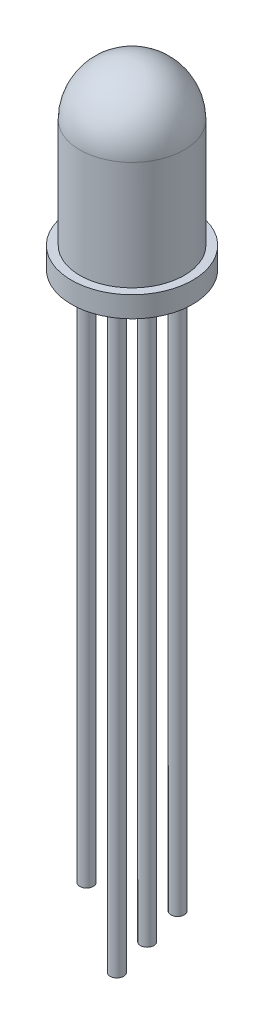
from build123d import *

# Parameters (mm, degrees)
SKETCH2_R           = 0.3219
BOSS_EXTRUDE1_DEPTH = 26.5
SKETCH2_3_R         = 0.3219
BOSS_EXTRUDE2_DEPTH = 29.5
SKETCH2_4_R         = 0.3219
BOSS_EXTRUDE3_DEPTH = 27.5
SKETCH2_5_R         = 0.3219
BOSS_EXTRUDE4_DEPTH = 25.5
SPLIT1_START        = -26.5
SPLIT1_OUTLINE_R    = 0.3219
SPLIT1_DEPTH        = 26.5
SPLIT1_START_2      = -29.5
SPLIT1_2_OUTLINE_R  = 0.3219
SPLIT1_2_DEPTH      = 29.5
SPLIT1_START_3      = -27.5
SPLIT1_3_OUTLINE_R  = 0.3219
SPLIT1_3_DEPTH      = 27.5
SPLIT1_START_4      = -25.5
SPLIT1_4_OUTLINE_R  = 0.3219
SPLIT1_4_DEPTH      = 25.5
SPLIT1_5_OUTLINE_R  = 2.9
SPLIT1_5_DEPTH      = 1
SPLIT1_6_OUTLINE_R  = 2.9
SPLIT1_6_DEPTH      = 30.5


# Read off the part's stored shape, not the designer's step: Split1
with BuildPart() as part:
    # Sketch1 → Revolve1 (revolve)
    with BuildSketch(Plane.XY, mode=Mode.PRIVATE) as revolve1_sk:
        with BuildLine():
            Line((0, 0), (2.9, 0))
            Line((2.9, 0), (2.9, 1))
            Line((2.9, 1), (2.5, 1))
            Line((2.5, 1), (2.5, 6.2))
            ThreePointArc((2.5, 6.2), (1.767766953, 7.967766953), (0, 8.7))
            Line((0, 8.7), (0, 0))
        make_face()
    revolve(revolve1_sk.sketch.rotate(Axis((0, 0, 0), (0, 1, 0)), 90), axis=Axis((0, 0, 0), (0, 1, 0)))

    # Sketch2 → Boss-Extrude1 (add)
    with BuildSketch(Plane.XZ):
        with Locations(Location((-2.1781, 0, 0), (0, 0, 270))):
            Circle(SKETCH2_R)
    extrude(amount=BOSS_EXTRUDE1_DEPTH)

    # Sketch2<3> → Boss-Extrude2 (add)
    with BuildSketch(Plane.XZ):
        with Locations(Location((-0.726033333, 0, 0), (0, 0, 270))):
            Circle(SKETCH2_3_R)
    extrude(amount=BOSS_EXTRUDE2_DEPTH)

    # Sketch2<4> → Boss-Extrude3 (add)
    with BuildSketch(Plane.XZ):
        with Locations(Location((0.726033333, 0, 0), (0, 0, 270))):
            Circle(SKETCH2_4_R)
    extrude(amount=BOSS_EXTRUDE3_DEPTH)

    # Sketch2<5> → Boss-Extrude4 (add)
    with BuildSketch(Plane.XZ):
        with Locations(Location((2.1781, 0, 0), (0, 0, 270))):
            Circle(SKETCH2_5_R)
    extrude(amount=BOSS_EXTRUDE4_DEPTH)

    # Split1 6 outline → Split1 6 (cut)
    with BuildSketch(Plane(origin=(0, 0, 0), x_dir=(1, 0, 0), z_dir=(0, 1, 0)).offset(SPLIT1_START_2)):
        Circle(SPLIT1_6_OUTLINE_R)
    extrude(amount=SPLIT1_6_DEPTH, mode=Mode.SUBTRACT)


with BuildPart() as body_2:
    # Split1 outline → Split1 (new body)
    with BuildSketch(Plane(origin=(0, 0, 0), x_dir=(1, 0, 0), z_dir=(0, 1, 0)).offset(SPLIT1_START)):
        with Locations((-2.1781, 0)):
            Circle(SPLIT1_OUTLINE_R)
    extrude(amount=SPLIT1_DEPTH)


with BuildPart() as body_3:
    # Split1 2 outline → Split1 2 (new body)
    with BuildSketch(Plane(origin=(0, 0, 0), x_dir=(1, 0, 0), z_dir=(0, 1, 0)).offset(SPLIT1_START_2)):
        with Locations((-0.726033333, 0)):
            Circle(SPLIT1_2_OUTLINE_R)
    extrude(amount=SPLIT1_2_DEPTH)


with BuildPart() as body_4:
    # Split1 3 outline → Split1 3 (new body)
    with BuildSketch(Plane(origin=(0, 0, 0), x_dir=(1, 0, 0), z_dir=(0, 1, 0)).offset(SPLIT1_START_3)):
        with Locations((0.726033333, 0)):
            Circle(SPLIT1_3_OUTLINE_R)
    extrude(amount=SPLIT1_3_DEPTH)


with BuildPart() as body_5:
    # Split1 4 outline → Split1 4 (new body)
    with BuildSketch(Plane(origin=(0, 0, 0), x_dir=(1, 0, 0), z_dir=(0, 1, 0)).offset(SPLIT1_START_4)):
        with Locations((2.1781, 0)):
            Circle(SPLIT1_4_OUTLINE_R)
    extrude(amount=SPLIT1_4_DEPTH)


with BuildPart() as body_6:
    # Split1 5 outline → Split1 5 (new body)
    with BuildSketch(Plane(origin=(0, 0, 0), x_dir=(1, 0, 0), z_dir=(0, 1, 0))):
        Circle(SPLIT1_5_OUTLINE_R)
    extrude(amount=SPLIT1_5_DEPTH)


solid = Compound([part.part, body_2.part, body_3.part, body_4.part, body_5.part, body_6.part])
